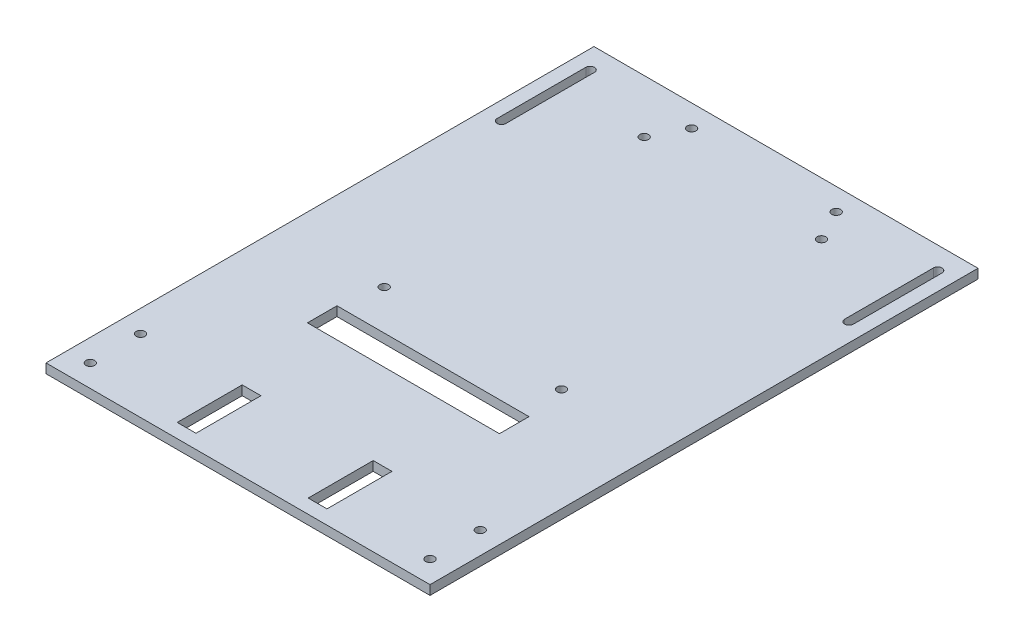
from build123d import *

# Parameters (mm, degrees)
SKETCH1_W               = 130
SKETCH1_H               = 184.5
BOSS_EXTRUDE1_DEPTH     = 3.175
SKETCH4_R               = 1.475
CUT_EXTRUDE3_DEPTH      = 113.894389254
SKETCH5_R               = 1.475
CUT_EXTRUDE4_DEPTH      = 10
SKETCH6_W               = 130
SKETCH6_H               = 3.175
BOSS_EXTRUDE2_DEPTH     = 1
CUT_EXTRUDE5_DEPTH      = 114.712985736
CUT_EXTRUDE5_DEPTH_BACK = 114.712985736
SKETCH7_W               = 6.35
SKETCH7_H               = 22
SKETCH8_W               = 65
SKETCH8_H               = 10
CUT_EXTRUDE6_DEPTH      = 10
SKETCH9_R               = 1.475
CUT_EXTRUDE7_DEPTH      = 75


with BuildPart() as part:
    # Sketch1 → Boss-Extrude1 (new body)
    with BuildSketch(Plane(origin=(0, 0, 0), x_dir=(1, 0, 0), z_dir=(0, 1, 0))):
        Rectangle(SKETCH1_W, SKETCH1_H)
    extrude(amount=BOSS_EXTRUDE1_DEPTH)

    # Sketch4 → Cut-Extrude3 (cut, through all)
    with BuildSketch(Plane(origin=(0, 0, 0), x_dir=(-1, 0, 0), z_dir=(0, -1, 0))):
        with Locations((-57.5, -84.75)):
            Circle(SKETCH4_R)
        with Locations((-57.5, -67.75)):
            Circle(SKETCH4_R)
        with Locations((57.5, -84.75)):
            Circle(SKETCH4_R)
        with Locations((57.5, -67.75)):
            Circle(SKETCH4_R)
        with BuildLine():
            Line((-57.35, 85.775), (-57.35, 55.775))
            ThreePointArc((-57.35, 55.775), (-58.825, 54.3), (-60.3, 55.775))
            Line((-60.3, 55.775), (-60.3, 85.775))
            ThreePointArc((-60.3, 85.775), (-58.825, 87.25), (-57.35, 85.775))
        make_face()
        with BuildLine():
            Line((60.3, 85.775), (60.3, 55.775))
            ThreePointArc((60.3, 55.775), (58.825, 54.3), (57.35, 55.775))
            Line((57.35, 55.775), (57.35, 85.775))
            ThreePointArc((57.35, 85.775), (58.825, 87.25), (60.3, 85.775))
        make_face()
    extrude(amount=-CUT_EXTRUDE3_DEPTH, mode=Mode.SUBTRACT)

    # Sketch5 → Cut-Extrude4 (cut)
    with BuildSketch(Plane.XZ):
        with Locations((-24.475, -85.775)):
            Circle(SKETCH5_R)
        with Locations((24.475, -85.775)):
            Circle(SKETCH5_R)
    extrude(amount=-CUT_EXTRUDE4_DEPTH, mode=Mode.SUBTRACT)

    # Sketch6 → Boss-Extrude2 (add)
    with BuildSketch(Plane(origin=(0, 0, -92.25), x_dir=(-1, 0, 0), z_dir=(0, 0, -1))):
        with Locations((0, 1.5875)):
            Rectangle(SKETCH6_W, SKETCH6_H)
    extrude(amount=BOSS_EXTRUDE2_DEPTH)

    # Sketch7 → Cut-Extrude5 (cut, two sides: drawn at the far end of the back side and taken through both)
    with BuildSketch(Plane(origin=(0, 3.175, 0), x_dir=(1, 0, 0), z_dir=(0, 1, 0)).offset(-CUT_EXTRUDE5_DEPTH_BACK)):
        with Locations((-22.175, -76.48843537)):
            Rectangle(SKETCH7_W, SKETCH7_H)
        with Locations((22.175, -76.48843537)):
            Rectangle(SKETCH7_W, SKETCH7_H)
    extrude(amount=CUT_EXTRUDE5_DEPTH + CUT_EXTRUDE5_DEPTH_BACK, mode=Mode.SUBTRACT)

    # Sketch8 → Cut-Extrude6 (cut)
    with BuildSketch(Plane.XZ):
        with Locations((0, 31.25)):
            Rectangle(SKETCH8_W, SKETCH8_H)
    extrude(amount=-CUT_EXTRUDE6_DEPTH, mode=Mode.SUBTRACT)

    # Sketch9 → Cut-Extrude7 (cut)
    with BuildSketch(Plane(origin=(0, 0, 0), x_dir=(-1, 0, 0), z_dir=(0, -1, 0))):
        with Locations((-30, 75.25)):
            Circle(SKETCH9_R)
        with Locations((30, 75.25)):
            Circle(SKETCH9_R)
        with Locations((-30, -12.75)):
            Circle(SKETCH9_R)
        with Locations((30, -12.75)):
            Circle(SKETCH9_R)
    extrude(amount=-CUT_EXTRUDE7_DEPTH, mode=Mode.SUBTRACT)


solid = part.part
